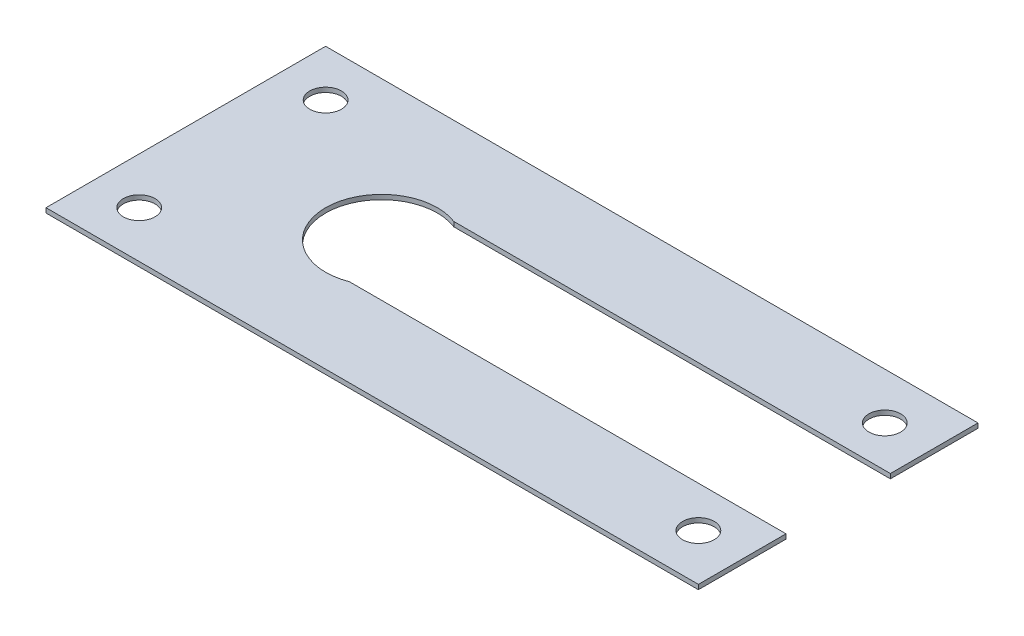
from build123d import *

# Parameters (mm, degrees)
ESQUISSE1_R               = 1.7
T_LE_DE_BASE_PLI_E1_DEPTH = 0.5


# Sheet-metal steps are written as plain solids
with BuildPart() as part:
    # Esquisse1 → Tôle de base pliée1 (new body)
    with BuildSketch(Plane(origin=(0, 0, 0), x_dir=(1, 0, 0), z_dir=(0, 1, 0))):
        with BuildLine():
            Line((-35, -15), (35, -15))
            Line((35, -15), (35, -5.6))
            Line((35, -5.6), (-11.845934077, -5.6))
            ThreePointArc((-11.845934077, -5.6), (-20, 0), (-11.845934077, 5.6))
            Line((-11.845934077, 5.6), (35, 5.6))
            Line((35, 5.6), (35, 15))
            Line((35, 15), (-35, 15))
            Line((-35, 15), (-35, -15))
        make_face()
        with Locations(Location((30, 10, 0), (0, 0, 270))):
            Circle(ESQUISSE1_R, mode=Mode.SUBTRACT)
        with Locations(Location((30, -10, 0), (0, 0, 90))):
            Circle(ESQUISSE1_R, mode=Mode.SUBTRACT)
        with Locations(Location((-30, -10, 0), (0, 0, 270))):
            Circle(ESQUISSE1_R, mode=Mode.SUBTRACT)
        with Locations(Location((-30, 10, 0), (0, 0, 90))):
            Circle(ESQUISSE1_R, mode=Mode.SUBTRACT)
    extrude(amount=-T_LE_DE_BASE_PLI_E1_DEPTH)


solid = part.part
